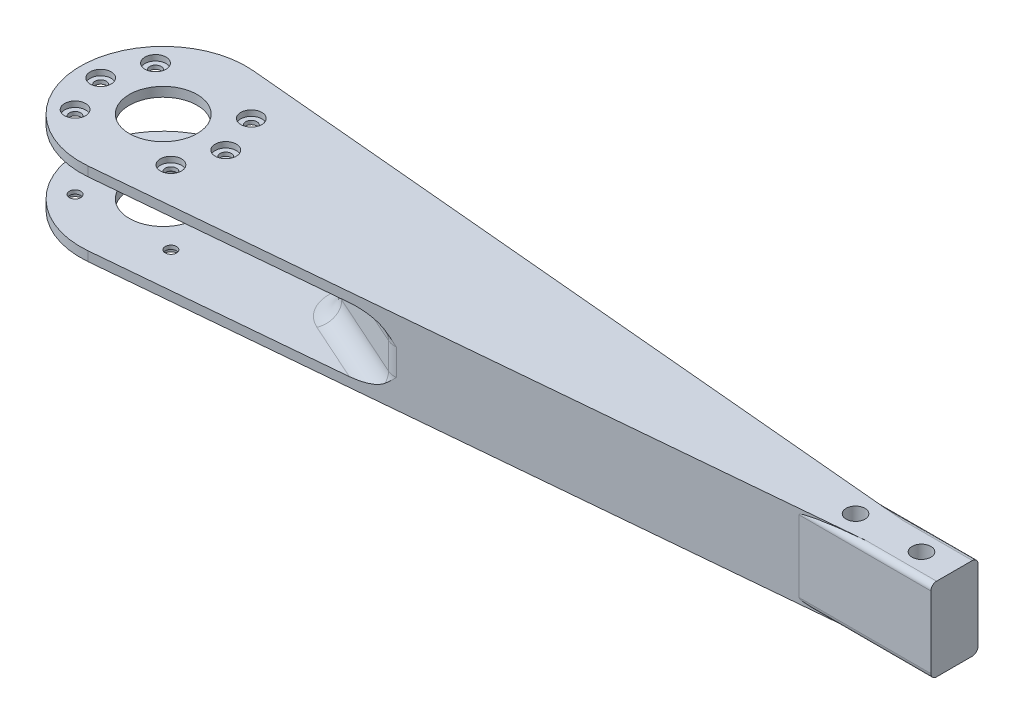
from build123d import *

# Parameters (mm, degrees)
SKETCH1_R           = 2.499999999999995
SKETCH1_R_2         = 2.4999999999999956
BOSS_EXTRUDE1_DEPTH = 22
SKETCH1_3_R         = 22
SKETCH1_3_R_2       = 1.499999999999997
SKETCH1_3_R_3       = 1.4999999999999987
SKETCH1_3_R_4       = 9
BOSS_EXTRUDE2_DEPTH = 2.5
BOSS_EXTRUDE3_START = 19.5
SKETCH1_4_R         = 22
SKETCH1_4_R_2       = 1.499999999999997
SKETCH1_4_R_3       = 1.4999999999999987
SKETCH1_4_R_4       = 9
BOSS_EXTRUDE3_DEPTH = 2.5
FILLET1_R           = 5
FILLET2_R           = 5
SKETCH2_R           = 2.8000000000000003
SKETCH2_R_2         = 2.799999999999998
SKETCH2_R_3         = 2.800000000000374
SKETCH2_R_4         = 2.800000000000002
SKETCH2_R_5         = 2.8000000000000007
CUT_EXTRUDE3_DEPTH  = 1.5
CUT_EXTRUDE4_START  = -20.5
SKETCH2_3_R         = 2.8000000000000003
SKETCH2_3_R_2       = 2.799999999999998
SKETCH2_3_R_3       = 2.800000000000374
SKETCH2_3_R_4       = 2.800000000000002
SKETCH2_3_R_5       = 2.8000000000000007
CUT_EXTRUDE4_DEPTH  = 1.5
FILLET3_R           = 1.5


with BuildPart() as part:
    # Sketch1 → Boss-Extrude1 (new body)
    with BuildSketch(Plane(origin=(0, 0, 0), x_dir=(1, 0, 0), z_dir=(0, 1, 0))):
        Polygon((210, 6.25), (175, 6.25), (75.7048097561628, 15.237597270585965), (41.813127412360984, 0), (75.70480975616282, -15.237597270585962), (175, -6.25), (210, -6.25), align=None)
        with Locations(Location((183.75, 8.7e-16, 0), (0, 0, 270))):
            Circle(SKETCH1_R, mode=Mode.SUBTRACT)
        with Locations(Location((201.24999999999997, 8.7e-16, 0), (0, 0, 270))):
            Circle(SKETCH1_R_2, mode=Mode.SUBTRACT)
    extrude(amount=BOSS_EXTRUDE1_DEPTH)

    # Sketch1<3> → Boss-Extrude2 (add)
    # profile 1 of 3: a face of its own
    with BuildSketch(Plane(origin=(0, 0, 0), x_dir=(1, 0, 0), z_dir=(0, 1, 0))):
        Circle(SKETCH1_3_R)
        with Locations(Location((-16.599999999999994, -4.07e-15, 0), (0, 0, 270))):
            Circle(SKETCH1_3_R_2, mode=Mode.SUBTRACT)
        with Locations(Location((-12.716337755775092, -10.670274320796484, 0), (0, 0, 270))):
            Circle(SKETCH1_3_R_3, mode=Mode.SUBTRACT)
        with Locations(Location((12.716337755775099, -10.67027432079648, 0), (0, 0, 270))):
            Circle(SKETCH1_3_R_3, mode=Mode.SUBTRACT)
        with Locations(Location((12.716337755775099, 10.67027432079648, 0), (0, 0, 270))):
            Circle(SKETCH1_3_R_3, mode=Mode.SUBTRACT)
        with Locations(Location((16.6, 0, 0), (0, 0, 270))):
            Circle(SKETCH1_3_R_2, mode=Mode.SUBTRACT)
        with Locations(Location((-12.716337755775095, 10.670274320796477, 0), (0, 0, 270))):
            Circle(SKETCH1_3_R_3, mode=Mode.SUBTRACT)
        with Locations(Location((0, 0, 0), (0, 0, 270))):
            Circle(SKETCH1_3_R_4, mode=Mode.SUBTRACT)
    # profile 2 of 3: a face of its own
    with BuildSketch(Plane(origin=(0, 0, 0), x_dir=(1, 0, 0), z_dir=(0, 1, 0))):
        with BuildLine():
            ThreePointArc((26, 0), (23.30625405943406, 11.524691827424864), (15.783190637145122, 20.661338129742095))
            Line((15.783190637145111, 20.661338129742038), (1.9831989455582573, 21.910429524368908))
            ThreePointArc((1.9831989455582602, 21.910429524368904), (16.242388629790288, 14.838625664085578), (22, 0))
            ThreePointArc((22, -5.39e-15), (16.24238862979029, -14.838625664085573), (1.9831989455582546, -21.910429524368904))
            Line((1.9831989455582573, -21.910429524368908), (15.783190637145054, -20.66133812974204))
            ThreePointArc((15.78319063714509, -20.66133812974212), (23.30625405943405, -11.524691827424883), (26, -6.37e-15))
        make_face()
    # profile 3 of 3: a face of its own
    with BuildSketch(Plane(origin=(0, 0, 0), x_dir=(1, 0, 0), z_dir=(0, 1, 0))):
        with BuildLine():
            Line((41.813127412360984, 0), (75.7048097561628, 15.237597270585965))
            Line((75.7048097561628, 15.237597270585965), (15.783190637145111, 20.661338129742038))
            ThreePointArc((15.783190637145122, 20.661338129742095), (23.30625405943406, 11.524691827424864), (26, 0))
            ThreePointArc((26, -6.37e-15), (23.30625405943405, -11.524691827424883), (15.78319063714509, -20.66133812974212))
            Line((15.783190637145054, -20.66133812974204), (75.70480975616282, -15.237597270585963))
            Line((75.70480975616282, -15.237597270585962), (41.813127412360984, 0))
        make_face()
    extrude(amount=BOSS_EXTRUDE2_DEPTH)

    # Sketch1<4> → Boss-Extrude3 (add)
    # profile 1 of 3: a face of its own
    with BuildSketch(Plane(origin=(0, 0, 0), x_dir=(1, 0, 0), z_dir=(0, 1, 0)).offset(BOSS_EXTRUDE3_START)):
        Circle(SKETCH1_4_R)
        with Locations(Location((-16.599999999999994, -4.07e-15, 0), (0, 0, 270))):
            Circle(SKETCH1_4_R_2, mode=Mode.SUBTRACT)
        with Locations(Location((-12.716337755775092, -10.670274320796484, 0), (0, 0, 270))):
            Circle(SKETCH1_4_R_3, mode=Mode.SUBTRACT)
        with Locations(Location((12.716337755775099, -10.67027432079648, 0), (0, 0, 270))):
            Circle(SKETCH1_4_R_3, mode=Mode.SUBTRACT)
        with Locations(Location((12.716337755775099, 10.67027432079648, 0), (0, 0, 270))):
            Circle(SKETCH1_4_R_3, mode=Mode.SUBTRACT)
        with Locations(Location((16.6, 0, 0), (0, 0, 270))):
            Circle(SKETCH1_4_R_2, mode=Mode.SUBTRACT)
        with Locations(Location((-12.716337755775095, 10.670274320796477, 0), (0, 0, 270))):
            Circle(SKETCH1_4_R_3, mode=Mode.SUBTRACT)
        with Locations(Location((0, 0, 0), (0, 0, 270))):
            Circle(SKETCH1_4_R_4, mode=Mode.SUBTRACT)
    # profile 2 of 3: a face of its own
    with BuildSketch(Plane(origin=(0, 0, 0), x_dir=(1, 0, 0), z_dir=(0, 1, 0)).offset(BOSS_EXTRUDE3_START)):
        with BuildLine():
            ThreePointArc((26, 0), (23.30625405943406, 11.524691827424864), (15.783190637145122, 20.661338129742095))
            Line((15.783190637145111, 20.661338129742038), (1.9831989455582573, 21.910429524368908))
            ThreePointArc((1.9831989455582602, 21.910429524368904), (16.242388629790288, 14.838625664085578), (22, 0))
            ThreePointArc((22, -5.39e-15), (16.24238862979029, -14.838625664085573), (1.9831989455582546, -21.910429524368904))
            Line((1.9831989455582573, -21.910429524368908), (15.783190637145054, -20.66133812974204))
            ThreePointArc((15.78319063714509, -20.66133812974212), (23.30625405943405, -11.524691827424883), (26, -6.37e-15))
        make_face()
    # profile 3 of 3: a face of its own
    with BuildSketch(Plane(origin=(0, 0, 0), x_dir=(1, 0, 0), z_dir=(0, 1, 0)).offset(BOSS_EXTRUDE3_START)):
        with BuildLine():
            Line((41.813127412360984, 0), (75.7048097561628, 15.237597270585965))
            Line((75.7048097561628, 15.237597270585965), (15.783190637145111, 20.661338129742038))
            ThreePointArc((15.783190637145122, 20.661338129742095), (23.30625405943406, 11.524691827424864), (26, 0))
            ThreePointArc((26, -6.37e-15), (23.30625405943405, -11.524691827424883), (15.78319063714509, -20.66133812974212))
            Line((15.783190637145054, -20.66133812974204), (75.70480975616282, -15.237597270585963))
            Line((75.70480975616282, -15.237597270585962), (41.813127412360984, 0))
        make_face()
    extrude(amount=BOSS_EXTRUDE3_DEPTH)

    # Fillet1
    fillet1_edges = [part.edges().sort_by_distance(p)[0] for p in [
        (75.7048097561628, 11, -15.237597270585965),
        (75.70480975616282, 11, 15.237597270585962),
        (41.813127412360984, 11, 0),
    ]]
    fillet(fillet1_edges, radius=FILLET1_R)

    # Fillet2
    # the kernel refuses this fillet: 5 mm, written as the material it adds along each edge
    with BuildSketch(Plane(origin=(74.50926767179394, 19.5, 14.700085186740369), x_dir=(-0.4100589591103126, 0, 0.9120590167600816), z_dir=(-0.9120590167600817, 0, -0.41005895911031254))) as fillet2_piece_1_section:
        with BuildLine():
            CenterArc((FILLET2_R, -FILLET2_R), FILLET2_R, 90, 90)
            Line((-1.62e-15, -FILLET2_R), (0, 0))
            Line((0, 0), (FILLET2_R, 0))
        make_face()
    fillet2_piece_1 = extrude(amount=24.72763947150388, mode=Mode.PRIVATE)
    fillet2_piece_1 = split(fillet2_piece_1, bisect_by=Plane(origin=(62.92164276949458, 18.35420314681747, 16.394651871485475), z_dir=(-0.09014540661628426, 0, -0.9959286147440413)), keep=Keep.TOP, mode=Mode.PRIVATE)
    add(fillet2_piece_1)
    with BuildSketch(Plane(origin=(74.50926767179394, 2.5, 14.700085186740369), x_dir=(-0.4100589591103126, 0, 0.9120590167600816), z_dir=(-0.9120590167600817, 0, -0.41005895911031254))) as fillet2_piece_2_section:
        with BuildLine():
            CenterArc((FILLET2_R, FILLET2_R), FILLET2_R, 180, 90)
            Line((-1.62e-15, FILLET2_R), (0, 0))
            Line((0, 0), (FILLET2_R, 0))
        make_face()
    fillet2_piece_2 = extrude(amount=24.72763947150388, mode=Mode.PRIVATE)
    fillet2_piece_2 = split(fillet2_piece_2, bisect_by=Plane(origin=(62.921642769494596, 3.6457968531825293, 16.394651871485472), z_dir=(-0.09014540661628426, 0, -0.9959286147440413)), keep=Keep.TOP, mode=Mode.PRIVATE)
    add(fillet2_piece_2)
    with BuildSketch(Plane(origin=(51.95620112861632, 19.5, -4.560295083800408), x_dir=(-0.41005895911031287, 0, -0.9120590167600817), z_dir=(0.9120590167600817, 0, -0.4100589591103128))) as fillet2_piece_3_section:
        with BuildLine():
            CenterArc((FILLET2_R, -FILLET2_R), FILLET2_R, 90, 90)
            Line((3.3e-16, -FILLET2_R), (0, 0))
            Line((0, 0), (FILLET2_R, 0))
        make_face()
    fillet2_piece_3 = extrude(amount=24.727639471503775, mode=Mode.PRIVATE)
    fillet2_piece_3 = split(fillet2_piece_3, bisect_by=Plane(origin=(62.921642769494525, 18.354203146817465, -16.39465187148548), z_dir=(-0.09014540661628426, 0, 0.9959286147440413)), keep=Keep.TOP, mode=Mode.PRIVATE)
    add(fillet2_piece_3)
    with BuildSketch(Plane(origin=(51.95620112861632, 2.5, -4.560295083800408), x_dir=(-0.41005895911031287, 0, -0.9120590167600817), z_dir=(0.9120590167600817, 0, -0.4100589591103128))) as fillet2_piece_4_section:
        with BuildLine():
            CenterArc((FILLET2_R, FILLET2_R), FILLET2_R, 180, 90)
            Line((3.3e-16, FILLET2_R), (0, 0))
            Line((0, 0), (FILLET2_R, 0))
        make_face()
    fillet2_piece_4 = extrude(amount=24.727639471503775, mode=Mode.PRIVATE)
    fillet2_piece_4 = split(fillet2_piece_4, bisect_by=Plane(origin=(62.921642769494554, 3.6457968531825298, -16.39465187148548), z_dir=(-0.09014540661628426, 0, 0.9959286147440413)), keep=Keep.TOP, mode=Mode.PRIVATE)
    add(fillet2_piece_4)
    with BuildSketch(Plane(origin=(76.5595624673455, 2.5, 10.139790102939958), x_dir=(-0.4100589591103129, 0, 0.9120590167600815), z_dir=(-0.9120590167600815, 0, -0.4100589591103129))) as fillet2_piece_5_section:
        with BuildLine():
            CenterArc((5.000000000000001 + FILLET2_R, FILLET2_R), FILLET2_R, 180, 90)
            Line((4.999999999999998, FILLET2_R), (5.000000000000001, 0))
            Line((5.000000000000001, 0), (5.000000000000001 + FILLET2_R, 0))
        make_face()
    fillet2_piece_5 = revolve(axis=Axis((76.5595624673455, 2.5, 10.139790102939958), (0, 1, 0)), revolution_arc=172.6260901636111, mode=Mode.PRIVATE)
    fillet2_piece_5 = split(fillet2_piece_5, bisect_by=Plane(origin=(74.84793823871587, 4.260840075663418, 15.315156073711647), z_dir=(-0.09014540661628426, 0, -0.9959286147440413)), keep=Keep.TOP, mode=Mode.PRIVATE)
    add(fillet2_piece_5)
    with BuildSketch(Plane(origin=(76.5595624673455, 19.5, 10.139790102939958), x_dir=(-0.4100589591103129, 0, 0.9120590167600815), z_dir=(-0.9120590167600815, 0, -0.4100589591103129))) as fillet2_piece_6_section:
        with BuildLine():
            CenterArc((5.000000000000001 + FILLET2_R, -FILLET2_R), FILLET2_R, 90, 90)
            Line((4.999999999999998, -FILLET2_R), (5.000000000000001, 0))
            Line((5.000000000000001, 0), (5.000000000000001 + FILLET2_R, 0))
        make_face()
    fillet2_piece_6 = revolve(axis=Axis((76.5595624673455, 19.5, 10.139790102939958), (0, 1, 0)), revolution_arc=172.6260901636111, mode=Mode.PRIVATE)
    fillet2_piece_6 = split(fillet2_piece_6, bisect_by=Plane(origin=(74.84793823871586, 17.739159924336587, 15.315156073711648), z_dir=(-0.09014540661628426, 0, -0.9959286147440413)), keep=Keep.TOP, mode=Mode.PRIVATE)
    add(fillet2_piece_6)
    with BuildSketch(Plane(origin=(76.55956246734539, 2.5, -10.139790102939964), x_dir=(-0.4100589591103157, 0, -0.9120590167600803), z_dir=(-0.9120590167600803, 0, 0.4100589591103157))) as fillet2_piece_7_section:
        with BuildLine():
            CenterArc((5.000000000000002 + FILLET2_R, -FILLET2_R), FILLET2_R, 90, 90)
            Line((5.000000000000002, -FILLET2_R), (5.000000000000002, 0))
            Line((5.000000000000002, 0), (5.000000000000002 + FILLET2_R, 0))
        make_face()
    fillet2_piece_7 = revolve(axis=Axis((76.55956246734539, 2.5, -10.139790102939964), (0, -1, 0)), revolution_arc=172.6260901636108, mode=Mode.PRIVATE)
    fillet2_piece_7 = split(fillet2_piece_7, bisect_by=Plane(origin=(74.84793824620773, 4.260840162303623, -15.31515607303353), z_dir=(-0.09014540661628426, 0, 0.9959286147440413)), keep=Keep.TOP, mode=Mode.PRIVATE)
    add(fillet2_piece_7)
    with BuildSketch(Plane(origin=(76.55956246734539, 19.5, -10.139790102939964), x_dir=(-0.4100589591103157, 0, -0.9120590167600803), z_dir=(-0.9120590167600803, 0, 0.4100589591103157))) as fillet2_piece_8_section:
        with BuildLine():
            CenterArc((5.000000000000002 + FILLET2_R, FILLET2_R), FILLET2_R, 180, 90)
            Line((5.000000000000002, FILLET2_R), (5.000000000000002, 0))
            Line((5.000000000000002, 0), (5.000000000000002 + FILLET2_R, 0))
        make_face()
    fillet2_piece_8 = revolve(axis=Axis((76.55956246734539, 19.5, -10.139790102939964), (0, -1, 0)), revolution_arc=172.62609016361083, mode=Mode.PRIVATE)
    fillet2_piece_8 = split(fillet2_piece_8, bisect_by=Plane(origin=(74.84793824632831, 17.739159836294988, -15.315156073022614), z_dir=(-0.09014540661628426, 0, 0.9959286147440413)), keep=Keep.TOP, mode=Mode.PRIVATE)
    add(fillet2_piece_8)
    with BuildSketch(Plane(origin=(54.006495924167886, 2.5, 2.88e-15), x_dir=(-0.4100589591103129, 0, -0.9120590167600815), z_dir=(0.9120590167600815, 0, -0.4100589591103129))) as fillet2_piece_9:
        with BuildLine():
            CenterArc((5.000000000000001 + FILLET2_R, FILLET2_R), FILLET2_R, 180, 90)
            Line((5.000000000000001, FILLET2_R), (5.000000000000001, 0))
            Line((5.000000000000001, 0), (5.000000000000001 + FILLET2_R, 0))
        make_face()
    revolve(axis=Axis((54.006495924167886, 2.5, 2.88e-15), (0, 1, 0)), revolution_arc=131.58292285209714)
    with BuildSketch(Plane(origin=(54.006495924167886, 19.5, 2.88e-15), x_dir=(-0.4100589591103129, 0, -0.9120590167600815), z_dir=(0.9120590167600815, 0, -0.4100589591103129))) as fillet2_piece_10:
        with BuildLine():
            CenterArc((5.000000000000001 + FILLET2_R, -FILLET2_R), FILLET2_R, 90, 90)
            Line((5.000000000000001, -FILLET2_R), (5.000000000000001, 0))
            Line((5.000000000000001, 0), (5.000000000000001 + FILLET2_R, 0))
        make_face()
    revolve(axis=Axis((54.006495924167886, 19.5, 2.88e-15), (0, 1, 0)), revolution_arc=131.58292285209714)

    # Sketch2 → Cut-Extrude3 (cut)
    with BuildSketch(Plane.XZ):
        with Locations(Location((12.716337755775099, 10.67027432079648, 0), (0, 0, 270))):
            Circle(SKETCH2_R)
        with Locations(Location((16.600000000000005, -1.1796e-13, 0), (0, 0, 270))):
            Circle(SKETCH2_R_2)
        with Locations(Location((12.71633775577447, -10.670274320796484, 0), (0, 0, 270))):
            Circle(SKETCH2_R_3)
        with Locations(Location((-12.716337755775092, 10.670274320796484, 0), (0, 0, 270))):
            Circle(SKETCH2_R)
        with Locations(Location((-16.600000000000005, -1.1623e-13, 0), (0, 0, 270))):
            Circle(SKETCH2_R_4)
        with Locations(Location((-12.716337755774944, -10.670274320796656, 0), (0, 0, 270))):
            Circle(SKETCH2_R_5)
    extrude(amount=-CUT_EXTRUDE3_DEPTH, mode=Mode.SUBTRACT)

    # Sketch2<3> → Cut-Extrude4 (cut)
    with BuildSketch(Plane.XZ.offset(CUT_EXTRUDE4_START)):
        with Locations(Location((12.716337755775099, 10.67027432079648, 0), (0, 0, 270))):
            Circle(SKETCH2_3_R)
        with Locations(Location((16.600000000000005, -1.1796e-13, 0), (0, 0, 270))):
            Circle(SKETCH2_3_R_2)
        with Locations(Location((12.71633775577447, -10.670274320796484, 0), (0, 0, 270))):
            Circle(SKETCH2_3_R_3)
        with Locations(Location((-12.716337755775092, 10.670274320796484, 0), (0, 0, 270))):
            Circle(SKETCH2_3_R)
        with Locations(Location((-16.600000000000005, -1.1623e-13, 0), (0, 0, 270))):
            Circle(SKETCH2_3_R_4)
        with Locations(Location((-12.716337755774944, -10.670274320796656, 0), (0, 0, 270))):
            Circle(SKETCH2_3_R_5)
    extrude(amount=-CUT_EXTRUDE4_DEPTH, mode=Mode.SUBTRACT)

    # Fillet3
    # the kernel refuses this fillet: 1.5 mm, written as the material it takes off along each edge
    with BuildSketch(Plane(origin=(213.75, 0, -6.25), x_dir=(0, 0, 1), z_dir=(-1, 0, 0))) as fillet3_piece_1_section:
        with BuildLine():
            CenterArc((FILLET3_R, FILLET3_R), FILLET3_R, 180, 90)
            Line((0, FILLET3_R), (0, 0))
            Line((0, 0), (FILLET3_R, 0))
        make_face()
    fillet3_piece_1 = extrude(amount=42.5, mode=Mode.PRIVATE)
    fillet3_piece_1 = split(fillet3_piece_1, bisect_by=Plane(origin=(195.92487896194191, 0.3590942723847128, -4.356007102857218), z_dir=(0.09014540661600601, 0, -0.9959286147440665)), keep=Keep.TOP, mode=Mode.PRIVATE)
    add(fillet3_piece_1, mode=Mode.SUBTRACT)
    with BuildSketch(Plane(origin=(171.25, 0, 6.25), x_dir=(0, 1, 0), z_dir=(1, 0, 0))) as fillet3_piece_2_section:
        with BuildLine():
            CenterArc((FILLET3_R, -FILLET3_R), FILLET3_R, 90, 90)
            Line((-2.2e-16, -FILLET3_R), (0, 0))
            Line((0, 0), (FILLET3_R, 0))
        make_face()
    fillet3_piece_2 = extrude(amount=42.5, mode=Mode.PRIVATE)
    fillet3_piece_2 = split(fillet3_piece_2, bisect_by=Plane(origin=(195.92487896194592, 0.35909427238465597, 4.356007102856864), z_dir=(0.09014540661600601, 0, 0.9959286147440665)), keep=Keep.TOP, mode=Mode.PRIVATE)
    add(fillet3_piece_2, mode=Mode.SUBTRACT)
    with BuildSketch(Plane(origin=(171.25, 22, 6.25), x_dir=(0, 0, -1), z_dir=(1, 0, 0))) as fillet3_piece_3_section:
        with BuildLine():
            CenterArc((FILLET3_R, -FILLET3_R), FILLET3_R, 90, 90)
            Line((0, -FILLET3_R), (0, 0))
            Line((0, 0), (FILLET3_R, 0))
        make_face()
    fillet3_piece_3 = extrude(amount=42.5, mode=Mode.PRIVATE)
    fillet3_piece_3 = split(fillet3_piece_3, bisect_by=Plane(origin=(195.9248789619462, 21.64090572761535, 4.3560071028568395), z_dir=(0.09014540661600601, 0, 0.9959286147440665)), keep=Keep.TOP, mode=Mode.PRIVATE)
    add(fillet3_piece_3, mode=Mode.SUBTRACT)
    with BuildSketch(Plane(origin=(213.75, 22, -6.25), x_dir=(0, 0, 1), z_dir=(-1, 0, 0))) as fillet3_piece_4_section:
        with BuildLine():
            CenterArc((FILLET3_R, -FILLET3_R), FILLET3_R, 90, 90)
            Line((0, -FILLET3_R), (0, 0))
            Line((0, 0), (FILLET3_R, 0))
        make_face()
    fillet3_piece_4 = extrude(amount=42.5, mode=Mode.PRIVATE)
    fillet3_piece_4 = split(fillet3_piece_4, bisect_by=Plane(origin=(195.92487896194174, 21.640905727615277, -4.356007102857232), z_dir=(0.09014540661600601, 0, -0.9959286147440665)), keep=Keep.TOP, mode=Mode.PRIVATE)
    add(fillet3_piece_4, mode=Mode.SUBTRACT)


solid = part.part
